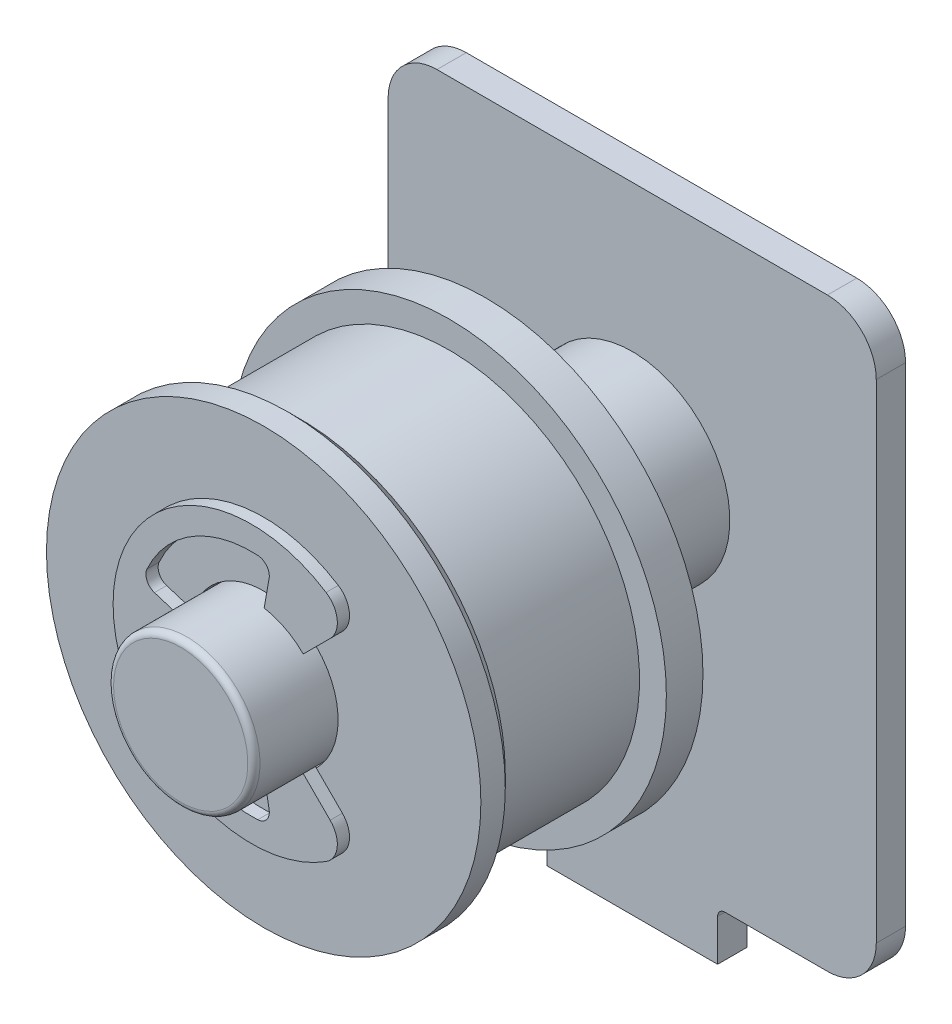
from build123d import *
from OCP.BRepFilletAPI import BRepFilletAPI_MakeChamfer

# Parameters (mm, degrees)
ESBO_O1_W                  = 97.4
ESBO_O1_H                  = 1.25
RESSALTO_EXTRUS_O1_DEPTH   = 6.2
ESBO_O2_W                  = 97.4
ESBO_O2_H                  = 1.25
RESSALTO_EXTRUS_O2_DEPTH   = 40.6
FILETE1_R                  = 1
ESBO_O3_R                  = 2
ESBO_O3_R_2                = 2.5
ESBO_O3_R_3                = 6
ESBO_O3_W                  = 4
ESBO_O3_H                  = 6
ESBO_O3_W_2                = 6
ESBO_O3_H_2                = 8
CORTE_EXTRUS_O1_DEPTH      = 40.6
ESBO_O6_R                  = 3
RESSALTO_EXTRUS_O3_DEPTH   = 22.5
ESBO_O7_R                  = 2.25
RESSALTO_EXTRUS_O4_DEPTH   = 12.3
FILETE2_R                  = 0.25
ESBO_O12_R                 = 4
RESSALTO_EXTRUS_O7_DEPTH   = 3
ESBO_O13_R                 = 4.5
RESSALTO_EXTRUS_O8_DEPTH   = 8.1
ESBO_O8_R                  = 16.365
ESBO_O8_R_2                = 2.3
RESSALTO_EXTRUS_O5_DEPTH   = 4
ESBO_O9_R                  = 4
ESBO_O9_R_2                = 2.3
RESSALTO_EXTRUS_O6_DEPTH   = 8.9
ESBO_O10_R                 = 13.865
ESBO_O10_R_2               = 4.9
CORTE_EXTRUS_O2_DEPTH      = 1
CORTE_EXTRUS_O3_START      = -1
ESBO_O11_R                 = 13.86
ESBO_O11_R_2               = 4.9
CORTE_EXTRUS_O3_DEPTH      = 1
ESBO_O14_R                 = 18.34
ESBO_O14_R_2               = 3.1
RESSALTO_EXTRUS_O9_DEPTH   = 4
ESBO_O15_R                 = 7.8
ESBO_O15_R_2               = 3.1
RESSALTO_EXTRUS_O10_DEPTH  = 11.6
RESSALTO_EXTRUS_O11_START  = -1.5
ESBO_O16_R                 = 8.9
ESBO_O16_R_2               = 3.1
RESSALTO_EXTRUS_O11_DEPTH  = 1.5
CHANFRO1_SIZE              = 0.5
ESBO_O17_R                 = 3.5
ESBO_O17_R_2               = 3.1
RESSALTO_EXTRUS_O12_DEPTH  = 0.5
CORTE_EXTRUS_O4_START      = -1
ESBO_O18_R                 = 15.84
ESBO_O18_R_2               = 8.9
CORTE_EXTRUS_O4_DEPTH      = 1
ESBO_O19_R                 = 15.825
ESBO_O19_R_2               = 8.9
CORTE_EXTRUS_O5_DEPTH      = 1
RESSALTO_EXTRUS_O13_DEPTH  = 0.5
ESBO_O21_R                 = 1.75
RESSALTO_EXTRUS_O14_DEPTH  = 0.92
ESBO_O23_R                 = 17.675026778
RESSALTO_EXTRUS_O15_DEPTH  = 15
FILETE4_R                  = 1
ESBO_O24_R                 = 2.05
ESBO_O24_R_2               = 1.75
RESSALTO_EXTRUS_O16_DEPTH  = 1
ESBO_O25_R                 = 2.5
RESSALTO_EXTRUS_O17_DEPTH  = 0.1
ESBO_O26_R                 = 1
RESSALTO_EXTRUS_O18_DEPTH  = 0.5
FILETE6_R                  = 0.1
ESBO_O27_R                 = 4.99
RESSALTO_EXTRUS_O19_DEPTH  = 16.57
RESSALTO_EXTRUS_O20_START  = -25
ESBO_O28_R                 = 1
RESSALTO_EXTRUS_O20_DEPTH  = 25
FILETE5_R                  = 0.25
ESBO_O29_R                 = 3.59
RESSALTO_EXTRUS_O21_DEPTH  = 6
ESBO_O30_R                 = 2.7
RESSALTO_EXTRUS_O22_DEPTH  = 2
FILETE7_R                  = 1.4
CORTE_EXTRUS_O6_DEPTH      = 1.4
ESBO_O32_R                 = 1.75
RESSALTO_EXTRUS_O23_DEPTH  = 7.8
CHANFRO2_SIZE              = 1
CHANFRO2_SIZE2             = 0.466307658
RESSALTO_EXTRUS_O24_DEPTH  = 10
ESBO_O34_R                 = 2
RESSALTO_EXTRUS_O25_DEPTH  = 5
ESBO_O35_R                 = 7.8
RESSALTO_EXTRUS_O26_DEPTH  = 7.6
ESBO_O37_R                 = 8.9
RESSALTO_EXTRUS_O27_DEPTH  = 1.5
CHANFRO3_SIZE              = 0.5
ESBO_O38_R                 = 8.9
RESSALTO_EXTRUS_O28_DEPTH  = 1.5
CORTE_EXTRUS_O7_DEPTH      = 16
CORTE_EXTRUS_O7_DEPTH_BACK = 35.5
ESBO_O39_R                 = 3.05
ESBO_O40_R                 = 4
RESSALTO_EXTRUS_O29_DEPTH  = 6
ESBO_O41_R                 = 3
RESSALTO_EXTRUS_O30_DEPTH  = 18.5
FILETE8_R                  = 0.25
RESSALTO_EXTRUS_O31_DEPTH  = 0.5
RESSALTO_EXTRUS_O32_DEPTH  = 1.2
FILETE9_R                  = 2
FILETE10_R                 = 0.3
FILETE11_R                 = 0.5
FILETE12_R                 = 0.25


with BuildPart() as part:
    # Esboço1 → Ressalto-extrusão1 (new body)
    with BuildSketch(Plane.XY):
        Rectangle(ESBO_O1_W, ESBO_O1_H)
    extrude(amount=RESSALTO_EXTRUS_O1_DEPTH)

    # Esboço2 → Ressalto-extrusão2 (add)
    with BuildSketch(Plane(origin=(0, -0.625, 0), x_dir=(1, 0, 0), z_dir=(0, 1, 0))):
        with Locations((0, -0.625)):
            Rectangle(ESBO_O2_W, ESBO_O2_H)
    extrude(amount=RESSALTO_EXTRUS_O2_DEPTH)

    # Filete1
    filete1_edges = [part.edges().sort_by_distance(p)[0] for p in [
        (48.7, 0, 6.2),
        (48.7, 39.975, 0.625),
        (-48.7, 39.975, 0.625),
        (-48.7, 0, 6.2),
    ]]
    fillet(filete1_edges, radius=FILETE1_R)

    # Esboço3 → Corte-extrusão1 (cut)
    with BuildSketch(Plane.XY.offset(1.25)):
        with Locations((-43.7, 4.975)):
            Circle(ESBO_O3_R)
        with Locations((0, 4.975)):
            Circle(ESBO_O3_R)
        with Locations((38.95, 19.8)):
            Circle(ESBO_O3_R_2)
        with Locations((14.7, 19.8)):
            Circle(ESBO_O3_R_3)
        with Locations((41.7, 30.975)):
            Rectangle(ESBO_O3_W, ESBO_O3_H)
        with Locations((41.7, 8.975)):
            Rectangle(ESBO_O3_W, ESBO_O3_H)
        with Locations((-33.7, 8.975)):
            Rectangle(ESBO_O3_W_2, ESBO_O3_H_2)
        with BuildLine():
            Line((27.7, 36.975), (30.7, 36.975))
            ThreePointArc((30.7, 36.975), (32.7, 34.975), (30.7, 32.975))
            Line((30.7, 32.975), (27.7, 32.975))
            ThreePointArc((27.7, 32.975), (25.7, 34.975), (27.7, 36.975))
        make_face()
        with Locations((-33.7, 30.975)):
            Rectangle(ESBO_O3_W_2, ESBO_O3_H_2)
    extrude(amount=-CORTE_EXTRUS_O1_DEPTH, mode=Mode.SUBTRACT)

    # Esboço6 → Ressalto-extrusão3 (add)
    with BuildSketch(Plane(origin=(0, 0, 0), x_dir=(-1, 0, 0), z_dir=(0, 0, -1))):
        with Locations((25.7, 19.8)):
            Circle(ESBO_O6_R)
    extrude(amount=-RESSALTO_EXTRUS_O3_DEPTH)

    # Esboço7 → Ressalto-extrusão4 (add)
    with BuildSketch(Plane(origin=(0, 0, 0), x_dir=(-1, 0, 0), z_dir=(0, 0, -1))):
        with Locations((4.1, 23.975)):
            Circle(ESBO_O7_R)
    extrude(amount=-RESSALTO_EXTRUS_O4_DEPTH)

    # Filete2
    filete2_edges = [part.edges().sort_by_distance(p)[0] for p in [
        (-22.7, 19.8, 22.5),
        (-1.85, 23.975, 12.3),
    ]]
    fillet(filete2_edges, radius=FILETE2_R)

    # Esboço12 → Ressalto-extrusão7 (add)
    with BuildSketch(Plane.XY):
        with Locations(Location((-4.1, 23.975, 0), (0, 0, 180))):
            Circle(ESBO_O12_R)
    extrude(amount=RESSALTO_EXTRUS_O7_DEPTH)

    # Esboço13 → Ressalto-extrusão8 (add)
    with BuildSketch(Plane(origin=(0, 0, 0), x_dir=(-1, 0, 0), z_dir=(0, 0, -1))):
        with Locations((25.7, 19.8)):
            Circle(ESBO_O13_R)
    extrude(amount=-RESSALTO_EXTRUS_O8_DEPTH)

    # Esboço8 → Ressalto-extrusão5 (add)
    with BuildSketch(Plane.XY.offset(3)):
        with Locations((-4.1, 23.975)):
            Circle(ESBO_O8_R)
        with Locations((-4.1, 23.975)):
            Circle(ESBO_O8_R_2, mode=Mode.SUBTRACT)
    extrude(amount=RESSALTO_EXTRUS_O5_DEPTH)

    # Esboço9 → Ressalto-extrusão6 (add)
    with BuildSketch(Plane.XY.offset(3)):
        with Locations(Location((-4.1, 23.975, 0), (0, 0, 180))):
            Circle(ESBO_O9_R)
        with Locations((-4.1, 23.975)):
            Circle(ESBO_O9_R_2, mode=Mode.SUBTRACT)
    extrude(amount=RESSALTO_EXTRUS_O6_DEPTH)

    # Esboço10 → Corte-extrusão2 (cut)
    with BuildSketch(Plane.XY.offset(7)):
        with Locations((-4.1, 23.975)):
            Circle(ESBO_O10_R)
        with Locations((-4.1, 23.975)):
            Circle(ESBO_O10_R_2, mode=Mode.SUBTRACT)
    extrude(amount=-CORTE_EXTRUS_O2_DEPTH, mode=Mode.SUBTRACT)

    # Esboço11 → Corte-extrusão3 (cut)
    with BuildSketch(Plane(origin=(0, 0, 3), x_dir=(-1, 0, 0), z_dir=(0, 0, -1)).offset(CORTE_EXTRUS_O3_START)):
        with Locations((4.1, 23.975)):
            Circle(ESBO_O11_R)
        with Locations(Location((4.1, 23.975, 0), (0, 0, 180))):
            Circle(ESBO_O11_R_2, mode=Mode.SUBTRACT)
    extrude(amount=CORTE_EXTRUS_O3_DEPTH, mode=Mode.SUBTRACT)

    # Esboço14 → Ressalto-extrusão9 (add)
    with BuildSketch(Plane.XY.offset(8.1)):
        with Locations(Location((-25.7, 19.8, 0), (0, 0, 15.545528491))):
            Circle(ESBO_O14_R)
        with Locations((-25.7, 19.8)):
            Circle(ESBO_O14_R_2, mode=Mode.SUBTRACT)
    extrude(amount=RESSALTO_EXTRUS_O9_DEPTH)

    # Esboço15 → Ressalto-extrusão10 (add)
    with BuildSketch(Plane.XY.offset(8.1)):
        with Locations((-25.7, 19.8)):
            Circle(ESBO_O15_R)
        with Locations((-25.7, 19.8)):
            Circle(ESBO_O15_R_2, mode=Mode.SUBTRACT)
    extrude(amount=RESSALTO_EXTRUS_O10_DEPTH)

    # Esboço16 → Ressalto-extrusão11 (add)
    with BuildSketch(Plane.XY.offset(19.7).offset(RESSALTO_EXTRUS_O11_START)):
        with Locations((-25.7, 19.8)):
            Circle(ESBO_O16_R)
        with Locations((-25.7, 19.8)):
            Circle(ESBO_O16_R_2, mode=Mode.SUBTRACT)
    extrude(amount=RESSALTO_EXTRUS_O11_DEPTH)

    # Chanfro1
    chanfro1_edges = [part.edges().sort_by_distance(p)[0] for p in [
        (-34.6, 19.8, 18.2),
    ]]
    chamfer(chanfro1_edges, length=CHANFRO1_SIZE)

    # Esboço17 → Ressalto-extrusão12 (add)
    with BuildSketch(Plane.XY.offset(19.7)):
        with Locations((-25.7, 19.8)):
            Circle(ESBO_O17_R)
        with Locations((-25.7, 19.8)):
            Circle(ESBO_O17_R_2, mode=Mode.SUBTRACT)
    extrude(amount=RESSALTO_EXTRUS_O12_DEPTH)

    # Esboço18 → Corte-extrusão4 (cut)
    with BuildSketch(Plane.XY.offset(12.1).offset(CORTE_EXTRUS_O4_START)):
        with Locations((-25.7, 19.8)):
            Circle(ESBO_O18_R)
        with Locations((-25.7, 19.8)):
            Circle(ESBO_O18_R_2, mode=Mode.SUBTRACT)
    extrude(amount=CORTE_EXTRUS_O4_DEPTH, mode=Mode.SUBTRACT)

    # Esboço19 → Corte-extrusão5 (cut)
    with BuildSketch(Plane(origin=(0, 0, 8.1), x_dir=(-1, 0, 0), z_dir=(0, 0, -1))):
        with Locations((25.7, 19.8)):
            Circle(ESBO_O19_R)
        with Locations(Location((25.7, 19.8, 0), (0, 0, 180))):
            Circle(ESBO_O19_R_2, mode=Mode.SUBTRACT)
    extrude(amount=-CORTE_EXTRUS_O5_DEPTH, mode=Mode.SUBTRACT)

    # Esboço20 → Ressalto-extrusão13 (add)
    with BuildSketch(Plane.XY.offset(20.2)):
        with BuildLine():
            Line((-28.322721615, 20.626940949), (-29.67498238, 21.05330713))
            ThreePointArc((-29.67498238, 21.05330713), (-29.981119219, 21.326162864), (-29.980184512, 21.736247175))
            ThreePointArc((-29.980184512, 21.736247175), (-28.137076875, 23.816178393), (-25.441102958, 24.490629478))
            ThreePointArc((-25.441102958, 24.490629478), (-25.076922131, 24.302102712), (-24.9762544, 23.904565262))
            Line((-24.9762544, 23.904565262), (-25.222467511, 22.508221321))
            ThreePointArc((-25.222467511, 22.508221321), (-24.430191314, 22.239279791), (-23.755456352, 21.744543648))
            Line((-23.755456352, 21.744543648), (-22.474650348, 23.025349652))
            ThreePointArc((-22.474650348, 23.025349652), (-22.187573749, 23.840156974), (-22.642480013, 24.574584803))
            ThreePointArc((-22.642480013, 24.574584803), (-31.36966388, 19.8), (-22.642480013, 15.025415197))
            ThreePointArc((-22.642480013, 15.025415197), (-22.187573749, 15.759843026), (-22.474650348, 16.574650348))
            Line((-22.474650348, 16.574650348), (-23.755456352, 17.855456352))
            ThreePointArc((-23.755456352, 17.855456352), (-24.430191314, 17.360720209), (-25.222467511, 17.091778679))
            Line((-25.222467511, 17.091778679), (-24.9762544, 15.695434738))
            ThreePointArc((-24.9762544, 15.695434738), (-25.076922131, 15.297897288), (-25.441102958, 15.109370522))
            ThreePointArc((-25.441102958, 15.109370522), (-28.137076875, 15.783821607), (-29.980184512, 17.863752825))
            ThreePointArc((-29.980184512, 17.863752825), (-29.981119219, 18.273837136), (-29.67498238, 18.54669287))
            Line((-29.67498238, 18.54669287), (-28.322721615, 18.973059051))
            ThreePointArc((-28.322721615, 18.973059051), (-28.45, 19.8), (-28.322721615, 20.626940949))
        make_face()
    extrude(amount=RESSALTO_EXTRUS_O13_DEPTH)

    # Esboço21 → Ressalto-extrusão14 (add)
    with BuildSketch(Plane(origin=(0, 0, 0), x_dir=(-1, 0, 0), z_dir=(0, 0, -1))):
        with BuildLine():
            Line((3.595164465, 5.161527392), (2.779555471, 20.88173038))
            ThreePointArc((2.779555471, 20.88173038), (-2.196938457, 32.222448714), (-13.433733778, 37.429349428))
            Line((-13.433733778, 37.429349428), (-29.134017665, 38.565609025))
            ThreePointArc((-29.134017665, 38.565609025), (-31.845866586, 37.610857858), (-32.993876913, 34.975))
            Line((-32.993876913, 34.975), (-32.993876913, 30.076020514))
            Line((-32.993876913, 30.076020514), (-30.487753652, 27.518219171))
            ThreePointArc((-30.487753652, 27.518219171), (-27.196938457, 7.727551286), (-7.477551833, 4.033530282))
            Line((-7.477551833, 4.033530282), (-4.87273477, 1.375))
            Line((-4.87273477, 1.375), (0, 1.375))
            ThreePointArc((0, 1.375), (2.610699007, 2.49624009), (3.595164465, 5.161527392))
        make_face()
        with Locations((0, 4.975)):
            Circle(ESBO_O21_R, mode=Mode.SUBTRACT)
        with Locations((-29.393876913, 34.975)):
            Circle(ESBO_O21_R, mode=Mode.SUBTRACT)
    extrude(amount=RESSALTO_EXTRUS_O14_DEPTH)

    # Esboço23 → Ressalto-extrusão15 (add)
    with BuildSketch(Plane.XY):
        with Locations((14.7, 19.8)):
            Circle(ESBO_O23_R)
    extrude(amount=-RESSALTO_EXTRUS_O15_DEPTH)

    # Filete4
    filete4_edges = [part.edges().sort_by_distance(p)[0] for p in [
        (-2.975026778, 19.8, -15),
    ]]
    fillet(filete4_edges, radius=FILETE4_R)

    # Esboço24 → Ressalto-extrusão16 (add)
    # profile 1 of 2: a face of its own
    with BuildSketch(Plane(origin=(0, 0, -0.92), x_dir=(-1, 0, 0), z_dir=(0, 0, -1))):
        with Locations((0, 4.975)):
            Circle(ESBO_O24_R)
        with Locations((0, 4.975)):
            Circle(ESBO_O24_R_2, mode=Mode.SUBTRACT)
    # profile 2 of 2: a face of its own
    with BuildSketch(Plane(origin=(0, 0, -0.92), x_dir=(-1, 0, 0), z_dir=(0, 0, -1))):
        with Locations((-29.393876913, 34.975)):
            Circle(ESBO_O24_R)
        with Locations((-29.393876913, 34.975)):
            Circle(ESBO_O24_R_2, mode=Mode.SUBTRACT)
    extrude(amount=RESSALTO_EXTRUS_O16_DEPTH)

    # Esboço25 → Ressalto-extrusão17 (add)
    with BuildSketch(Plane(origin=(0, 0, -15), x_dir=(-1, 0, 0), z_dir=(0, 0, -1))):
        with Locations(Location((-14.7, 19.8, 0), (0, 0, 180))):
            Circle(ESBO_O25_R)
    extrude(amount=RESSALTO_EXTRUS_O17_DEPTH)

    # Esboço26 → Ressalto-extrusão18 (add)
    with BuildSketch(Plane(origin=(0, 0, -15.1), x_dir=(-1, 0, 0), z_dir=(0, 0, -1))):
        with Locations((-14.7, 19.8)):
            Circle(ESBO_O26_R)
    extrude(amount=RESSALTO_EXTRUS_O18_DEPTH)

    # Filete6
    filete6_edges = [part.edges().sort_by_distance(p)[0] for p in [
        (12.2, 19.8, -15.1),
    ]]
    fillet(filete6_edges, radius=FILETE6_R - 0.0001)  # a hair under: the kernel refuses the full size

    # Esboço27 → Ressalto-extrusão19 (add)
    with BuildSketch(Plane.XY.offset(-15)):
        with Locations(Location((14.7, 19.8, 0), (0, 0, 180))):
            Circle(ESBO_O27_R)
    extrude(amount=RESSALTO_EXTRUS_O19_DEPTH)

    # Esboço28 → Ressalto-extrusão20 (add)
    with BuildSketch(Plane(origin=(0, 0, -15.6), x_dir=(-1, 0, 0), z_dir=(0, 0, -1)).offset(RESSALTO_EXTRUS_O20_START)):
        with Locations((-14.7, 19.8)):
            Circle(ESBO_O28_R)
    extrude(amount=RESSALTO_EXTRUS_O20_DEPTH)

    # Filete5
    filete5_edges = [part.edges().sort_by_distance(p)[0] for p in [
        (15.7, 19.8, -15.6),
        (15.7, 19.8, 9.4),
    ]]
    fillet(filete5_edges, radius=FILETE5_R)

    # Esboço29 → Ressalto-extrusão21 (add)
    with BuildSketch(Plane.XY.offset(9.15)):
        with Locations((14.7, 19.8)):
            Circle(ESBO_O29_R)
    extrude(amount=-RESSALTO_EXTRUS_O21_DEPTH)

    # Esboço30 → Ressalto-extrusão22 (add)
    with BuildSketch(Plane.XY.offset(1.25)):
        with Locations(Location((0, 4.975, 0), (0, 0, 180))):
            Circle(ESBO_O30_R)
        with Locations(Location((29.393876913, 34.975, 0), (0, 0, 227.672748848))):
            Circle(ESBO_O30_R)
    extrude(amount=RESSALTO_EXTRUS_O22_DEPTH)

    # Filete7
    filete7_edges = [part.edges().sort_by_distance(p)[0] for p in [
        (2.7, 4.975, 3.25),
        (31.211960314, 36.971139461, 3.25),
    ]]
    fillet(filete7_edges, radius=FILETE7_R)

    # Esboço31 → Corte-extrusão6 (cut)
    with BuildSketch(Plane.XY.offset(3.25)):
        with BuildLine():
            Line((29.093876913, 37.175), (29.693876913, 37.175))
            ThreePointArc((29.693876913, 37.175), (29.83529827, 37.116421356), (29.893876913, 36.975))
            Line((29.893876913, 36.975), (29.893876913, 35.975))
            ThreePointArc((29.893876913, 35.975), (30.040323523, 35.621446609), (30.393876913, 35.475))
            Line((30.393876913, 35.475), (31.393876913, 35.475))
            ThreePointArc((31.393876913, 35.475), (31.53529827, 35.416421356), (31.593876913, 35.275))
            Line((31.593876913, 35.275), (31.593876913, 34.675))
            ThreePointArc((31.593876913, 34.675), (31.53529827, 34.533578644), (31.393876913, 34.475))
            Line((31.393876913, 34.475), (30.393876913, 34.475))
            ThreePointArc((30.393876913, 34.475), (30.040323523, 34.328553391), (29.893876913, 33.975))
            Line((29.893876913, 33.975), (29.893876913, 32.975))
            ThreePointArc((29.893876913, 32.975), (29.83529827, 32.833578644), (29.693876913, 32.775))
            Line((29.693876913, 32.775), (29.093876913, 32.775))
            ThreePointArc((29.093876913, 32.775), (28.952455557, 32.833578644), (28.893876913, 32.975))
            Line((28.893876913, 32.975), (28.893876913, 33.975))
            ThreePointArc((28.893876913, 33.975), (28.747430304, 34.328553391), (28.393876913, 34.475))
            Line((28.393876913, 34.475), (27.393876913, 34.475))
            ThreePointArc((27.393876913, 34.475), (27.252455557, 34.533578644), (27.193876913, 34.675))
            Line((27.193876913, 34.675), (27.193876913, 35.275))
            ThreePointArc((27.193876913, 35.275), (27.252455557, 35.416421356), (27.393876913, 35.475))
            Line((27.393876913, 35.475), (28.393876913, 35.475))
            ThreePointArc((28.393876913, 35.475), (28.747430304, 35.621446609), (28.893876913, 35.975))
            Line((28.893876913, 35.975), (28.893876913, 36.975))
            ThreePointArc((28.893876913, 36.975), (28.952455557, 37.116421356), (29.093876913, 37.175))
        make_face()
        with BuildLine():
            Line((-0.142061447, 7.325028719), (0.457938553, 7.325028719))
            ThreePointArc((0.457938553, 7.325028719), (0.59935991, 7.266450075), (0.657938553, 7.125028719))
            Line((0.657938553, 7.125028719), (0.657938553, 6.125028719))
            ThreePointArc((0.657938553, 6.125028719), (0.804385163, 5.771475328), (1.157938553, 5.625028719))
            Line((1.157938553, 5.625028719), (2.157938553, 5.625028719))
            ThreePointArc((2.157938553, 5.625028719), (2.29935991, 5.566450075), (2.357938553, 5.425028719))
            Line((2.357938553, 5.425028719), (2.357938553, 4.825028719))
            ThreePointArc((2.357938553, 4.825028719), (2.29935991, 4.683607363), (2.157938553, 4.625028719))
            Line((2.157938553, 4.625028719), (1.157938553, 4.625028719))
            ThreePointArc((1.157938553, 4.625028719), (0.804385163, 4.478582109), (0.657938553, 4.125028719))
            Line((0.657938553, 4.125028719), (0.657938553, 3.125028719))
            ThreePointArc((0.657938553, 3.125028719), (0.59935991, 2.983607363), (0.457938553, 2.925028719))
            Line((0.457938553, 2.925028719), (-0.142061447, 2.925028719))
            ThreePointArc((-0.142061447, 2.925028719), (-0.283482803, 2.983607363), (-0.342061447, 3.125028719))
            Line((-0.342061447, 3.125028719), (-0.342061447, 4.125028719))
            ThreePointArc((-0.342061447, 4.125028719), (-0.488508056, 4.478582109), (-0.842061447, 4.625028719))
            Line((-0.842061447, 4.625028719), (-1.842061447, 4.625028719))
            ThreePointArc((-1.842061447, 4.625028719), (-1.983482803, 4.683607363), (-2.042061447, 4.825028719))
            Line((-2.042061447, 4.825028719), (-2.042061447, 5.425028719))
            ThreePointArc((-2.042061447, 5.425028719), (-1.983482803, 5.566450075), (-1.842061447, 5.625028719))
            Line((-1.842061447, 5.625028719), (-0.842061447, 5.625028719))
            ThreePointArc((-0.842061447, 5.625028719), (-0.488508056, 5.771475328), (-0.342061447, 6.125028719))
            Line((-0.342061447, 6.125028719), (-0.342061447, 7.125028719))
            ThreePointArc((-0.342061447, 7.125028719), (-0.283482803, 7.266450075), (-0.142061447, 7.325028719))
        make_face()
    extrude(amount=-CORTE_EXTRUS_O6_DEPTH, mode=Mode.SUBTRACT)

    # Esboço32 → Ressalto-extrusão23 (add)
    with BuildSketch(Plane(origin=(0, 0, 1.25), x_dir=(-1, 0, 0), z_dir=(0, 0, -1))):
        with Locations((0, 4.975)):
            Circle(ESBO_O32_R)
        with Locations(Location((-29.393876913, 34.975, 0), (0, 0, 180))):
            Circle(ESBO_O32_R)
    extrude(amount=RESSALTO_EXTRUS_O23_DEPTH)

    # Chanfro2: one chamfer whose edges measure the first distance from different faces: ONE call of the kernel's chamfer builder (chamfer() names one face for all edges)
    chanfro2_edges_1 = [part.edges().sort_by_distance(p)[0] for p in [
        (1.75, 4.975, -6.55),
    ]]
    chanfro2_side_1 = [part.faces().sort_by_distance(p)[0] for p in [
        (1.75, 4.975, -4.235),
    ]]
    chanfro2_edges_2 = [part.edges().sort_by_distance(p)[0] for p in [
        (27.643876913, 34.975, -6.55),
    ]]
    chanfro2_side_2 = [part.faces().sort_by_distance(p)[0] for p in [
        (27.643876913, 34.975, -4.235),
    ]]
    chanfro2 = BRepFilletAPI_MakeChamfer(part.part.solid().wrapped)
    for e in chanfro2_edges_1:
        chanfro2.Add(CHANFRO2_SIZE, CHANFRO2_SIZE2, e.wrapped, chanfro2_side_1[0].wrapped)  # the first distance lies on this face
    for e in chanfro2_edges_2:
        chanfro2.Add(CHANFRO2_SIZE, CHANFRO2_SIZE2, e.wrapped, chanfro2_side_2[0].wrapped)  # the first distance lies on this face
    add(Compound.cast(chanfro2.Shape()), mode=Mode.REPLACE)

    # Esboço33 → Ressalto-extrusão24 (add)
    with BuildSketch(Plane(origin=(0, 0, -0.92), x_dir=(-1, 0, 0), z_dir=(0, 0, -1))):
        with BuildLine():
            Line((3.196311276, 12.849099671), (3.224269109, 12.846096875))
            Line((3.224269109, 12.846096875), (4.292171901, 22.788912554))
            Line((4.292171901, 22.788912554), (2.690076099, 22.960984796))
            ThreePointArc((2.690076099, 22.960984796), (2.95476648, 20.646044994), (2.912651997, 18.316402606))
            Line((2.912651997, 18.316402606), (3.196311276, 12.849099671))
        make_face()
        with BuildLine():
            Line((1.622173307, 13.018169117), (3.196311276, 12.849099671))
            Line((3.196311276, 12.849099671), (2.912651997, 18.316402606))
            ThreePointArc((2.912651997, 18.316402606), (2.472970379, 15.617218633), (1.622173307, 13.018169117))
        make_face()
    extrude(amount=RESSALTO_EXTRUS_O24_DEPTH)

    # Esboço34 → Ressalto-extrusão25 (add)
    with BuildSketch(Plane(origin=(-1.823505509, -0.195852632, 0), x_dir=(0, 0, 1), z_dir=(-0.9942815679049348, -0.10679027916671441, 0))):
        with Locations(Location((-5.92, 18.116957941, 0), (0, 0, 270))):
            Circle(ESBO_O34_R)
    extrude(amount=RESSALTO_EXTRUS_O25_DEPTH)

    # Filete11
    filete11_edges = [part.edges().sort_by_distance(p)[0] for p in [
        (0, -0.625, 0),
    ]]
    fillet(filete11_edges, radius=FILETE11_R)

    # Filete12
    filete12_edges = [part.edges().sort_by_distance(p)[0] for p in [
        (0, 0.625, 1.25),
    ]]
    fillet(filete12_edges, radius=FILETE12_R)


with BuildPart() as body_2:
    # Esboço35 → Ressalto-extrusão26 (new body)
    with BuildSketch(Plane.XY.offset(12.1)):
        with Locations(Location((-398.7, 19.8, 0), (0, 0, 180))):
            Circle(ESBO_O35_R)
    extrude(amount=RESSALTO_EXTRUS_O26_DEPTH)

    # Esboço37 → Ressalto-extrusão27 (add)
    with BuildSketch(Plane.XY.offset(19.7)):
        with Locations((-398.7, 19.8)):
            Circle(ESBO_O37_R)
    extrude(amount=-RESSALTO_EXTRUS_O27_DEPTH)

    # Chanfro3
    chanfro3_edges = [body_2.edges().sort_by_distance(p)[0] for p in [
        (-407.6, 19.8, 18.2),
    ]]
    chamfer(chanfro3_edges, length=CHANFRO3_SIZE)

    # Esboço38 → Ressalto-extrusão28 (add)
    with BuildSketch(Plane(origin=(0, 0, 12.1), x_dir=(-1, 0, 0), z_dir=(0, 0, -1))):
        with Locations(Location((398.7, 19.8, 0), (0, 0, 180))):
            Circle(ESBO_O38_R)
    extrude(amount=RESSALTO_EXTRUS_O28_DEPTH)

    # Esboço39 → Corte-extrusão7 (cut, two sides: drawn at the far end of the back side and taken through both)
    with BuildSketch(Plane.XY.offset(19.7).offset(-CORTE_EXTRUS_O7_DEPTH_BACK)):
        with Locations(Location((-398.7, 19.8, 0), (0, 0, 180))):
            Circle(ESBO_O39_R)
    extrude(amount=CORTE_EXTRUS_O7_DEPTH + CORTE_EXTRUS_O7_DEPTH_BACK, mode=Mode.SUBTRACT)

    # Esboço40 → Ressalto-extrusão29 (add)
    with BuildSketch(Plane(origin=(0, 0, 10.6), x_dir=(-1, 0, 0), z_dir=(0, 0, -1))):
        with Locations((398.7, 19.8)):
            Circle(ESBO_O40_R)
    extrude(amount=RESSALTO_EXTRUS_O29_DEPTH)

    # Esboço41 → Ressalto-extrusão30 (add)
    with BuildSketch(Plane(origin=(0, 0, 4.6), x_dir=(-1, 0, 0), z_dir=(0, 0, -1))):
        with Locations((398.7, 19.8)):
            Circle(ESBO_O41_R)
    extrude(amount=-RESSALTO_EXTRUS_O30_DEPTH)

    # Filete8
    filete8_edges = [body_2.edges().sort_by_distance(p)[0] for p in [
        (-395.7, 19.8, 23.1),
    ]]
    fillet(filete8_edges, radius=FILETE8_R)

    # Esboço42 → Ressalto-extrusão31 (add)
    with BuildSketch(Plane.XY.offset(19.7)):
        with BuildLine():
            Line((-401.322721615, 20.626940949), (-402.67498238, 21.05330713))
            ThreePointArc((-402.67498238, 21.05330713), (-402.981119219, 21.326162864), (-402.980184512, 21.736247175))
            ThreePointArc((-402.980184512, 21.736247175), (-401.137076875, 23.816178393), (-398.441102958, 24.490629478))
            ThreePointArc((-398.441102958, 24.490629478), (-398.076922131, 24.302102712), (-397.9762544, 23.904565262))
            Line((-397.9762544, 23.904565262), (-398.222467511, 22.508221321))
            ThreePointArc((-398.222467511, 22.508221321), (-397.430191314, 22.239279791), (-396.755456352, 21.744543648))
            Line((-396.755456352, 21.744543648), (-395.474650348, 23.025349652))
            ThreePointArc((-395.474650348, 23.025349652), (-395.187573749, 23.840156974), (-395.642480013, 24.574584803))
            ThreePointArc((-395.642480013, 24.574584803), (-404.36966388, 19.8), (-395.642480013, 15.025415197))
            ThreePointArc((-395.642480013, 15.025415197), (-395.187573749, 15.759843026), (-395.474650348, 16.574650348))
            Line((-395.474650348, 16.574650348), (-396.755456352, 17.855456352))
            ThreePointArc((-396.755456352, 17.855456352), (-397.430191314, 17.360720209), (-398.222467511, 17.091778679))
            Line((-398.222467511, 17.091778679), (-397.9762544, 15.695434738))
            ThreePointArc((-397.9762544, 15.695434738), (-398.076922131, 15.297897288), (-398.441102958, 15.109370522))
            ThreePointArc((-398.441102958, 15.109370522), (-401.137076875, 15.783821607), (-402.980184512, 17.863752825))
            ThreePointArc((-402.980184512, 17.863752825), (-402.981119219, 18.273837136), (-402.67498238, 18.54669287))
            Line((-402.67498238, 18.54669287), (-401.322721615, 18.973059051))
            ThreePointArc((-401.322721615, 18.973059051), (-401.45, 19.8), (-401.322721615, 20.626940949))
        make_face()
    extrude(amount=RESSALTO_EXTRUS_O31_DEPTH)

    # Esboço43 → Ressalto-extrusão32 (add)
    with BuildSketch(Plane(origin=(0, 0, 4.6), x_dir=(-1, 0, 0), z_dir=(0, 0, -1))):
        Polygon((402.2, 5.8), (402.2, 3.8), (395.2, 3.8), (395.2, 5.8), (388.7, 5.8), (388.7, 29.8), (408.7, 29.8), (408.7, 5.8), align=None)
    extrude(amount=RESSALTO_EXTRUS_O32_DEPTH)

    # Filete9
    filete9_edges = [body_2.edges().sort_by_distance(p)[0] for p in [
        (-408.7, 5.8, 4),
        (-408.7, 29.8, 4),
        (-388.7, 29.8, 4),
        (-388.7, 5.8, 4),
    ]]
    fillet(filete9_edges, radius=FILETE9_R)

    # Filete10
    filete10_edges = [body_2.edges().sort_by_distance(p)[0] for p in [
        (-395.2, 5.8, 4),
        (-402.2, 5.8, 4),
    ]]
    fillet(filete10_edges, radius=FILETE10_R)


solid = body_2.part
